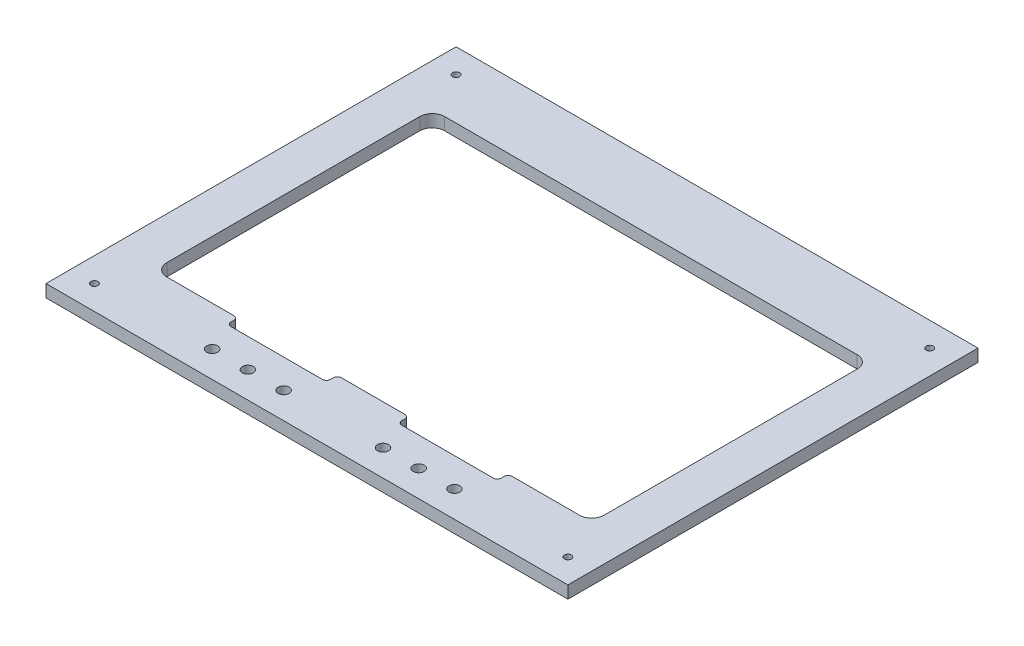
from build123d import *

# Parameters (mm, degrees)
SKETCH1_W              = 266.7
SKETCH1_H              = 209.55
BOSS_EXTRUDE1_DEPTH    = 6.35
M3_CLEARANCE_HOLE1_D   = 3.6
SKETCH4_W              = 223.52
SKETCH4_H              = 141.986
CUT_EXTRUDE1_DEPTH     = 170.706645789
F_10_CLEARANCE_HOLE1_D = 5.6134
SKETCH7_W              = 50.8
SKETCH7_H              = 5.588
CUT_EXTRUDE2_DEPTH     = 170.706645789
FILLET1_R              = 6.35
FILLET2_R              = 2.032


with BuildPart() as part:
    # Sketch1 → Boss-Extrude1 (new body)
    with BuildSketch(Plane(origin=(0, 0, 0), x_dir=(1, 0, 0), z_dir=(0, 1, 0))):
        Rectangle(SKETCH1_W, SKETCH1_H)
    extrude(amount=BOSS_EXTRUDE1_DEPTH)

    # M3 Clearance Hole1 (through all)
    with Locations(Plane(origin=(0, 6.35, 0), x_dir=(1, 0, 0), z_dir=(0, 1, 0))):
        with Locations((121.0056, -92.4306), (-121.0056, -92.4306), (-121.0056, 92.4306), (121.0056, 92.4306)):
            Hole(M3_CLEARANCE_HOLE1_D / 2)

    # Sketch4 → Cut-Extrude1 (cut, through all)
    with BuildSketch(Plane(origin=(0, 6.35, 0), x_dir=(1, 0, 0), z_dir=(0, 1, 0))):
        Rectangle(SKETCH4_W, SKETCH4_H)
    extrude(amount=-CUT_EXTRUDE1_DEPTH, mode=Mode.SUBTRACT)

    # #10 Clearance Hole1 (through all)
    with Locations(Plane(origin=(0, 6.35, 0), x_dir=(1, 0, 0), z_dir=(0, 1, 0))):
        with Locations((-61.9125, -91.313), (-43.65625, -91.313), (-25.4, -91.313), (25.4, -91.313), (43.65625, -91.313), (61.9125, -91.313)):
            Hole(F_10_CLEARANCE_HOLE1_D / 2)

    # Sketch7 → Cut-Extrude2 (cut, through all)
    with BuildSketch(Plane(origin=(0, 6.35, 0), x_dir=(1, 0, 0), z_dir=(0, 1, 0))):
        with Locations((-43.65625, -73.787)):
            Rectangle(SKETCH7_W, SKETCH7_H)
        with Locations((43.65625, -73.787)):
            Rectangle(SKETCH7_W, SKETCH7_H)
    extrude(amount=-CUT_EXTRUDE2_DEPTH, mode=Mode.SUBTRACT)

    # Fillet1
    fillet1_edges = [part.edges().sort_by_distance(p)[0] for p in [
        (111.76, 3.175, -70.993),
        (111.76, 3.175, 70.993),
        (-111.76, 3.175, 70.993),
        (-111.76, 3.175, -70.993),
    ]]
    fillet(fillet1_edges, radius=FILLET1_R)

    # Fillet2
    fillet2_edges = [part.edges().sort_by_distance(p)[0] for p in [
        (69.05625, 3.175, 70.993),
        (69.05625, 3.175, 76.581),
        (18.25625, 3.175, 76.581),
        (18.25625, 3.175, 70.993),
        (-18.25625, 3.175, 70.993),
        (-18.25625, 3.175, 76.581),
        (-69.05625, 3.175, 70.993),
        (-69.05625, 3.175, 76.581),
    ]]
    fillet(fillet2_edges, radius=FILLET2_R)


solid = part.part
